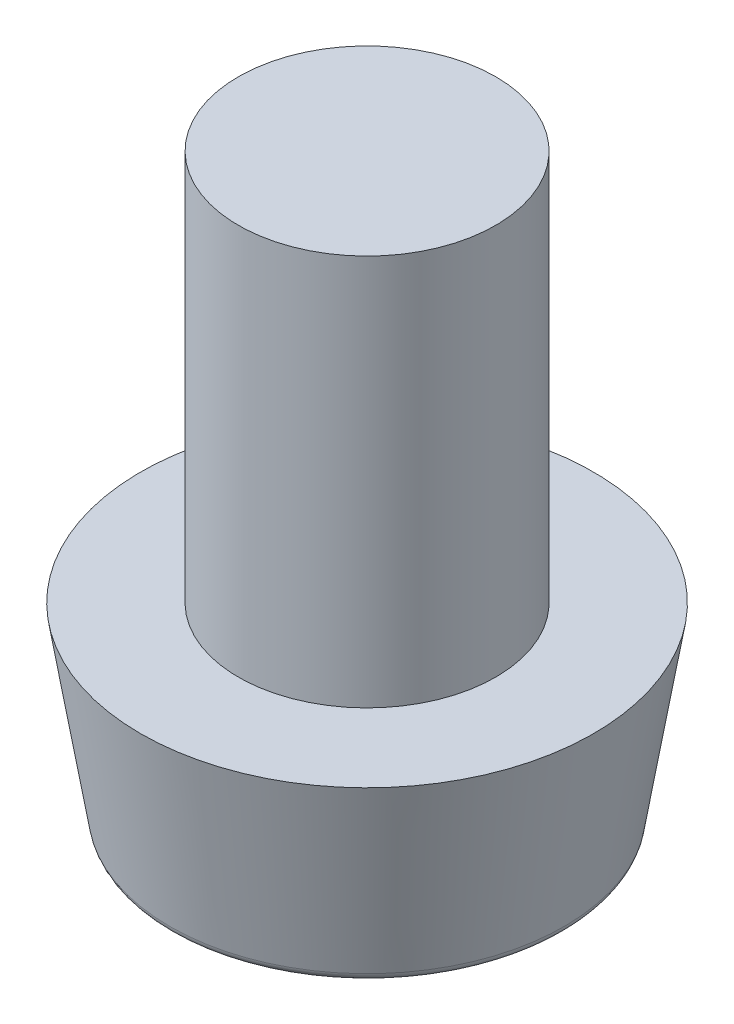
from build123d import *

# Parameters (mm, degrees)
ESQUISSE1_R        = 2.2
BOSS_EXTRU_1_DEPTH = 1.85
ESQUISSE2_R        = 1.25
BOSS_EXTRU_2_DEPTH = 3.8
CHANFREIN1_SIZE    = 1.85
CHANFREIN1_SIZE_2  = 0.3
CONG_1_R           = 0.1


with BuildPart() as part:
    # Esquisse1 → Boss.-Extru.1 (new body)
    with BuildSketch(Plane(origin=(0, 0, 0), x_dir=(1, 0, 0), z_dir=(0, 1, 0))):
        with Locations(Location((0, 0, 0), (0, 0, 270))):
            Circle(ESQUISSE1_R)
    extrude(amount=BOSS_EXTRU_1_DEPTH)

    # Esquisse2 → Boss.-Extru.2 (add)
    with BuildSketch(Plane(origin=(0, 1.85, 0), x_dir=(1, 0, 0), z_dir=(0, 1, 0))):
        with Locations(Location((0, 0, 0), (0, 0, 90))):
            Circle(ESQUISSE2_R)
    extrude(amount=BOSS_EXTRU_2_DEPTH)

    # Chanfrein1
    # the kernel refuses this chamfer: 1.85, 0.3 mm, written as the material it takes off along each edge
    with BuildSketch(Plane(origin=(0, 0, 0), x_dir=(0, 0, 1), z_dir=(-1, 0, 0))) as chanfrein1_piece_1:
        Polygon((2.2, CHANFREIN1_SIZE), (2.2 - CHANFREIN1_SIZE_2, 0), (2.2, 0), align=None)
    revolve(axis=Axis((0, 0, 0), (0, 1, 0)), mode=Mode.SUBTRACT)

    # Congé1
    cong_1_edges = [part.edges().sort_by_distance(p)[0] for p in [
        (0, 0, -1.9),
    ]]
    fillet(cong_1_edges, radius=CONG_1_R)


solid = part.part
